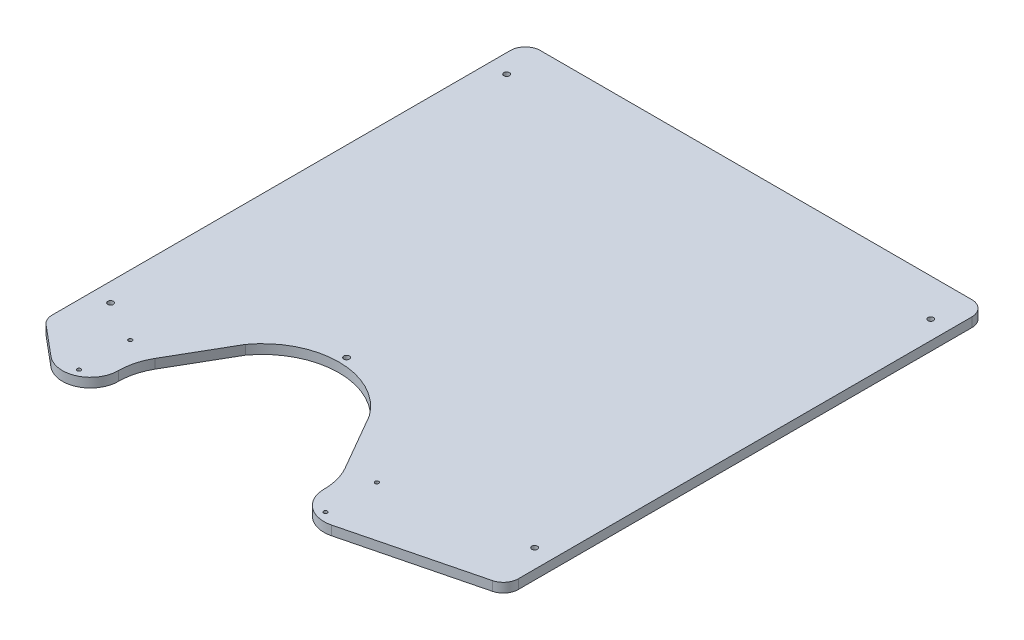
from build123d import *

# Parameters (mm, degrees)
ESQUISSE1_R             = 1
BOSS_EXTRU_1_DEPTH      = 5
ESQUISSE2_R             = 1.5
ENL_V_MAT_EXTRU_1_DEPTH = 275.48654739


with BuildPart() as part:
    # Esquisse1 → Boss.-Extru.1 (new body)
    with BuildSketch(Plane(origin=(0, 0, 0), x_dir=(1, 0, 0), z_dir=(0, 1, 0))):
        with BuildLine():
            Line((-115.5, 31.2), (115.5, 31.2))
            ThreePointArc((115.5, 31.2), (121.156854249, 28.856854249), (123.5, 23.2))
            Line((123.5, 23.2), (123.5, -219.563455357))
            ThreePointArc((123.5, -219.563455357), (121.809339782, -224.482015259), (117.451942122, -227.321671773))
            Line((117.451942122, -227.321671773), (48.659891479, -244.629528902))
            ThreePointArc((48.659891479, -244.629528902), (45.510605443, -245.074180006), (42.33836323, -244.8448408))
            ThreePointArc((42.33836323, -244.8448408), (33.490774319, -239.702526143), (30, -230.082873123))
            ThreePointArc((30, -230.082873123), (28.945508514, -222.073215083), (25.853895909, -214.609402001))
            Line((25.853895909, -214.609402001), (10.681549424, -188.330127019))
            Line((10.681549424, -188.330127019), (8.181549424, -184))
            ThreePointArc((8.181549424, -184), (-25, -167.082873123), (-58.181549424, -184))
            Line((-58.181549424, -184), (-60.681549424, -188.330127019))
            Line((-60.681549424, -188.330127019), (-75.853895909, -214.609402001))
            ThreePointArc((-75.853895909, -214.609402001), (-78.945508514, -222.073215083), (-80, -230.082873123))
            ThreePointArc((-80, -230.082873123), (-81.87001368, -237.335697347), (-87.013794564, -242.780137503))
            ThreePointArc((-87.013794564, -242.780137503), (-96.012583909, -245.048656558), (-104.623781388, -241.588646969))
            Line((-104.623781388, -241.588646969), (-120.632683407, -228.198311355))
            ThreePointArc((-120.632683407, -228.198311355), (-122.747808885, -225.448529171), (-123.5, -222.061898637))
            Line((-123.5, -222.061898637), (-123.5, 23.2))
            ThreePointArc((-123.5, 23.2), (-121.156854249, 28.856854249), (-115.5, 31.2))
        make_face()
        with Locations((41, -212.75)):
            Circle(ESQUISSE1_R, mode=Mode.SUBTRACT)
        with Locations((41, -240.25)):
            Circle(ESQUISSE1_R, mode=Mode.SUBTRACT)
        with Locations((-91, -212.75)):
            Circle(ESQUISSE1_R, mode=Mode.SUBTRACT)
        with Locations((-91, -240.25)):
            Circle(ESQUISSE1_R, mode=Mode.SUBTRACT)
    extrude(amount=-BOSS_EXTRU_1_DEPTH)

    # Esquisse2 → Enlèv. mat.-Extru.1 (cut, through all)
    with BuildSketch(Plane(origin=(0, 0, 0), x_dir=(1, 0, 0), z_dir=(0, 1, 0))):
        with Locations((-113.5, 11.2)):
            Circle(ESQUISSE2_R)
        with Locations((-25, -163)):
            Circle(ESQUISSE2_R)
        with Locations((113.5, 11.2)):
            Circle(ESQUISSE2_R)
        with Locations((113.5, -200.8)):
            Circle(ESQUISSE2_R)
        with Locations((-113.5, -200.8)):
            Circle(ESQUISSE2_R)
    extrude(amount=-ENL_V_MAT_EXTRU_1_DEPTH, mode=Mode.SUBTRACT)


solid = part.part
